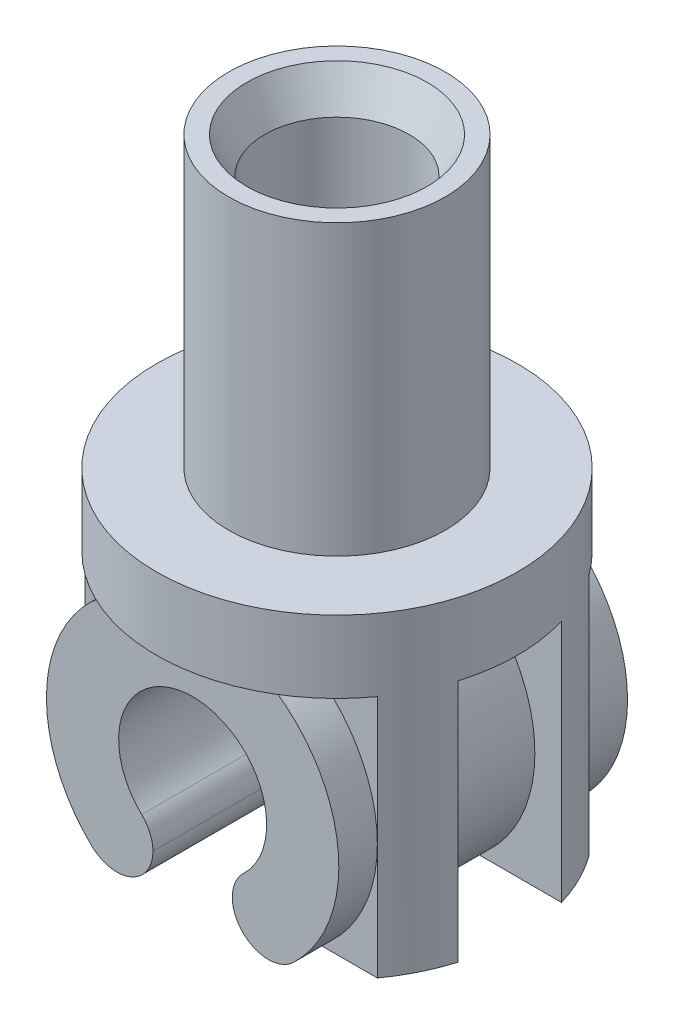
from build123d import *
from build123d.topology import SkipClean

# Parameters (mm, degrees)
BOSS_EXTRUDE9_DEPTH       = 5.6
BOSS_EXTRUDE9_DEPTH_BACK  = 2
SKETCH16_W                = 8
SKETCH16_H                = 3.5
BOSS_EXTRUDE11_DEPTH      = 8
CHAMFER2_SIZE             = 1.5
SKETCH17_W                = 3.94
SKETCH17_H                = 8
BOSS_EXTRUDE12_DEPTH      = 6.3
CUT_EXTRUDE2_START        = -5.6
CUT_EXTRUDE2_DEPTH        = 3.6
SKETCH21_R                = 1.5
BOSS_EXTRUDE14_DEPTH      = 3.6
CHAMFER4_SIZE             = 1
CUT_EXTRUDE3_DEPTH        = 3.6
SPLIT1_START              = -2
SPLIT1_DEPTH              = 7.6
SKETCH22_R                = 5
BOSS_EXTRUDE15_DEPTH      = 2
SKETCH23_R                = 3
BOSS_EXTRUDE16_DEPTH      = 8
CUT_EXTRUDE4_DEPTH        = 32.952026383
CUT_EXTRUDE4_DEPTH_BACK   = 8
SKETCH24_R                = 2
CHAMFER5_SIZE             = 0.5
CHAMFER5_SIZE2            = 1
BOSS_EXTRUDE17_DEPTH      = 8
CUT_EXTRUDE6_DEPTH        = 15.719504629
CUT_EXTRUDE6_DEPTH_BACK   = 15.719504629
FILLET2_R                 = 1
BOSS_EXTRUDE18_REACH      = 31.245
BOSS_EXTRUDE18_END_RADIUS = 4.05
SKETCH27_W                = 2.08
SKETCH27_H                = 1.5
BOSS_EXTRUDE19_START      = 3.538587
SKETCH27_3_W              = 2.08
SKETCH27_3_H              = 1.5
BOSS_EXTRUDE19_DEPTH      = 2.937113
CUT_EXTRUDE7_DEPTH        = 15.289597343
CUT_EXTRUDE7_DEPTH_BACK   = 15.289597343
SKETCH29_W                = 1.95
SKETCH29_H                = 0.274787005
BOSS_EXTRUDE20_DEPTH      = 1.5
BOSS_EXTRUDE21_START      = -4.364299
SKETCH29_3_W              = 1.95
SKETCH29_3_H              = 0.274787005
BOSS_EXTRUDE21_DEPTH      = 1.5
BOSS_EXTRUDE22_DEPTH      = 6.750486925


# Read off the part's stored shape, not the designer's step: Split1
# Some blends are built 0.0001 mm under size
with BuildPart() as part:
    # Sketch14 → Boss-Extrude9 (new, two sides: drawn at the far end of the back side and taken through both)
    with BuildSketch(Plane(origin=(0, 0, 0), x_dir=(1, 0, 0), z_dir=(0, 1, 0)).offset(-BOSS_EXTRUDE9_DEPTH_BACK)):
        with BuildLine():
            Line((-4.172171186, -20.619968889), (-4.172171186, -25.619968889))
            Line((-4.172171186, -25.619968889), (7.827828814, -25.619968889))
            Line((7.827828814, -25.619968889), (7.827828814, -20.619968889))
            ThreePointArc((7.827828814, -20.619968889), (1.827828814, -14.619968889), (-4.172171186, -20.619968889))
        make_face()
    extrude(amount=BOSS_EXTRUDE9_DEPTH + BOSS_EXTRUDE9_DEPTH_BACK)

    # Sketch16 → Boss-Extrude11 (add)
    with BuildSketch(Plane.XY.offset(25.619968889)):
        with Locations((1.827828814, 1.75)):
            Rectangle(SKETCH16_W, SKETCH16_H)
    extrude(amount=BOSS_EXTRUDE11_DEPTH)

    # Chamfer2
    chamfer2_edges = [part.edges().sort_by_distance(p)[0] for p in [
        (1.827828814, -2, 14.619968889),
        (7.827828814, 5.6, 23.119968889),
        (1.827828814, 5.6, 14.619968889),
        (-4.172171186, -2, 23.119968889),
        (-4.172171186, 5.6, 23.119968889),
        (7.827828814, -2, 23.119968889),
    ]]
    chamfer(chamfer2_edges, length=CHAMFER2_SIZE)

    # Sketch17 → Boss-Extrude12 (add)
    with BuildSketch(Plane.XZ.offset(2)):
        with Locations((1.827828814, 21.619968889)):
            Rectangle(SKETCH17_W, SKETCH17_H)
    extrude(amount=BOSS_EXTRUDE12_DEPTH)

    # Sketch20 → Cut-Extrude2 (cut)
    with BuildSketch(Plane(origin=(0, 5.6, 0), x_dir=(1, 0, 0), z_dir=(0, 1, 0)).offset(CUT_EXTRUDE2_START)):
        with BuildLine():
            Line((7.827828814, -20.619968889), (-4.172171186, -20.619968889))
            ThreePointArc((-4.172171186, -20.619968889), (1.827828814, -14.619968889), (7.827828814, -20.619968889))
        make_face()
    extrude(amount=CUT_EXTRUDE2_DEPTH, mode=Mode.SUBTRACT)

    # Sketch21 → Boss-Extrude14 (add)
    with BuildSketch(Plane(origin=(0, 0, 0), x_dir=(1, 0, 0), z_dir=(0, 1, 0))):
        with BuildLine():
            ThreePointArc((7.827828814, -20.619968889), (7.63955943, -19.128732072), (7.086566399, -17.731080001))
            ThreePointArc((7.086566399, -17.731080001), (6.279209969, -19.350325806), (4.990106474, -20.619968889))
            Line((4.990106474, -20.619968889), (7.827828814, -20.619968889))
        make_face()
        with BuildLine():
            ThreePointArc((-1.334448847, -20.619968889), (-2.623552342, -19.350325806), (-3.430908771, -17.731080001))
            ThreePointArc((-3.430908771, -17.731080001), (-3.983901803, -19.128732072), (-4.172171186, -20.619968889))
            Line((-4.172171186, -20.619968889), (-1.334448847, -20.619968889))
        make_face()
        with Locations(Location((1.827828814, -16.119968889, 0), (0, 0, 90.000763944))):
            Circle(SKETCH21_R)
    extrude(amount=BOSS_EXTRUDE14_DEPTH)

    # Chamfer4
    # the kernel refuses this chamfer: 1 mm, written as the material it adds along each edge
    with BuildSketch(Plane(origin=(1.827828814, 3.6, 16.119968889), x_dir=(-1.3333338100422289e-05, 0, -0.999999999911111), z_dir=(0.999999999911111, 0, -1.3333338100422289e-05))) as chamfer4_piece_1_section:
        Polygon((1.5, -CHAMFER4_SIZE), (1.5 + CHAMFER4_SIZE, 0), (1.5, 0), align=None)
    chamfer4_piece_1 = revolve(axis=Axis((1.827828814, 3.6, 16.119968889), (0, 1, 0)), mode=Mode.PRIVATE)
    chamfer4_piece_1 = chamfer4_piece_1 & Plane(origin=(1.827828814, 3.111670507, 20.619968889), x_dir=(1, 0, 0), z_dir=(0, -1, 0)) * Cylinder(6, 10, mode=Mode.PRIVATE)
    add(chamfer4_piece_1)
    with BuildSketch(Plane(origin=(1.827828814, 0, 16.119968889), x_dir=(-1.3333338100422289e-05, 0, -0.999999999911111), z_dir=(0.999999999911111, 0, -1.3333338100422289e-05))) as chamfer4_piece_2_section:
        Polygon((1.5 + CHAMFER4_SIZE, 0), (1.5, CHAMFER4_SIZE), (1.5, 0), align=None)
    chamfer4_piece_2 = revolve(axis=Axis((1.827828814, 0, 16.119968889), (0, 1, 0)), mode=Mode.PRIVATE)
    chamfer4_piece_2 = chamfer4_piece_2 & Plane(origin=(1.827828814, 0.488329493, 20.619968889), x_dir=(1, 0, 0), z_dir=(0, -1, 0)) * Cylinder(6, 10, mode=Mode.PRIVATE)
    add(chamfer4_piece_2)

    # Sketch21<3> → Cut-Extrude3 (cut)
    with BuildSketch(Plane(origin=(0, 0, 0), x_dir=(1, 0, 0), z_dir=(0, 1, 0))):
        with BuildLine():
            Line((4.990106474, -20.619968889), (-1.334448847, -20.619968889))
            ThreePointArc((-1.334448847, -20.619968889), (1.827828814, -21.619968889), (4.990106474, -20.619968889))
        make_face()
    extrude(amount=CUT_EXTRUDE3_DEPTH, mode=Mode.SUBTRACT)

    # Split1 outline → Split1 (cut)
    with BuildSketch(Plane(origin=(0, 0, 0), x_dir=(1, 0, 0), z_dir=(0, 1, 0)).offset(SPLIT1_START)):
        with BuildLine():
            Line((7.827828814, -25.619968889), (7.827828814, -20.619968889))
            ThreePointArc((7.827828814, -20.619968889), (1.827828814, -14.619968889), (-4.172171186, -20.619968889))
            Line((-4.172171186, -20.619968889), (-4.172171186, -25.619968889))
            Line((-4.172171186, -25.619968889), (-2.172171186, -25.619968889))
            Line((-2.172171186, -25.619968889), (-2.172171186, -33.619968889))
            Line((-2.172171186, -33.619968889), (5.827828814, -33.619968889))
            Line((5.827828814, -33.619968889), (5.827828814, -25.619968889))
            Line((5.827828814, -25.619968889), (7.827828814, -25.619968889))
        make_face()
    extrude(amount=SPLIT1_DEPTH, mode=Mode.SUBTRACT)

    # Sketch22 → Boss-Extrude15 (add)
    with BuildSketch(Plane(origin=(0, -2, 0), x_dir=(1, 0, 0), z_dir=(0, 1, 0))):
        with Locations(Location((1.827828814, -21.619968889, 0), (0, 0, 270))):
            Circle(SKETCH22_R)
    extrude(amount=BOSS_EXTRUDE15_DEPTH)

    # Sketch23 → Boss-Extrude16 (add)
    with BuildSketch(Plane(origin=(0, 0, 0), x_dir=(1, 0, 0), z_dir=(0, 1, 0))):
        with Locations(Location((1.827828814, -21.619968889, 0), (0, 0, 270))):
            Circle(SKETCH23_R)
    extrude(amount=BOSS_EXTRUDE16_DEPTH)

    # Sketch24 → Cut-Extrude4 (cut, two sides: drawn at the far end of the back side and taken through both)
    with BuildSketch(Plane(origin=(0, 8, 0), x_dir=(1, 0, 0), z_dir=(0, 1, 0)).offset(-CUT_EXTRUDE4_DEPTH_BACK)):
        with Locations(Location((1.827828814, -21.619968889, 0), (0, 0, 270))):
            Circle(SKETCH24_R)
    extrude(amount=CUT_EXTRUDE4_DEPTH + CUT_EXTRUDE4_DEPTH_BACK, mode=Mode.SUBTRACT)

    # Chamfer5
    chamfer5_edges = [part.edges().sort_by_distance(p)[0] for p in [
        (1.827828814, 8, 19.619968889),
    ]]
    chamfer5_side = [part.faces().sort_by_distance(p)[0] for p in [
        (1.827828814, 8, 18.704821703),
    ]]
    chamfer(chamfer5_edges, length=CHAMFER5_SIZE, length2=CHAMFER5_SIZE2, reference=chamfer5_side[0])

    # Sketch25 → Boss-Extrude17 (add)
    with BuildSketch(Plane.XY.offset(25.619968889)):
        with BuildLine():
            Line((3.797828814, -8.3), (2.927828814, -8.3))
            Line((2.927828814, -8.3), (2.927828814, -9.436343053))
            ThreePointArc((2.927828814, -9.436343053), (5.057186335, -7.982712899), (5.877828814, -5.538587289))
            ThreePointArc((5.877828814, -5.538587289), (5.319318467, -3.486271524), (3.797828814, -2))
            Line((3.797828814, -2), (3.797828814, -4.971489414))
            ThreePointArc((3.797828814, -4.971489414), (3.857730289, -5.252230867), (3.877828814, -5.538587289))
            ThreePointArc((3.877828814, -5.538587289), (3.857730289, -5.82494371), (3.797828814, -6.105685164))
            Line((3.797828814, -6.105685164), (3.797828814, -8.3))
        make_face()
        with BuildLine():
            Line((0.727828814, -9.436343053), (0.727828814, -8.3))
            Line((0.727828814, -8.3), (-0.142171186, -8.3))
            Line((-0.142171186, -8.3), (-0.142171186, -6.105685164))
            ThreePointArc((-0.142171186, -6.105685164), (-0.222171186, -5.538587289), (-0.142171186, -4.971489414))
            Line((-0.142171186, -4.971489414), (-0.142171186, -2))
            ThreePointArc((-0.142171186, -2), (-2.194735605, -6.009199123), (0.727828814, -9.436343053))
        make_face()
        with BuildLine():
            Line((-0.142171186, -2), (-0.142171186, -4.971489414))
            ThreePointArc((-0.142171186, -4.971489414), (1.827828814, -3.488587289), (3.797828814, -4.971489414))
            Line((3.797828814, -4.971489414), (3.797828814, -2))
            Line((3.797828814, -2), (-0.142171186, -2))
        make_face()
        with BuildLine():
            ThreePointArc((3.797828814, -6.105685164), (3.469243788, -6.766698391), (2.927828814, -7.268471678))
            Line((2.927828814, -7.268471678), (2.927828814, -8.3))
            Line((2.927828814, -8.3), (3.797828814, -8.3))
            Line((3.797828814, -8.3), (3.797828814, -6.105685164))
        make_face()
        with BuildLine():
            Line((0.727828814, -8.3), (0.727828814, -7.268471678))
            ThreePointArc((0.727828814, -7.268471678), (0.186413839, -6.766698391), (-0.142171186, -6.105685164))
            Line((-0.142171186, -6.105685164), (-0.142171186, -8.3))
            Line((-0.142171186, -8.3), (0.727828814, -8.3))
        make_face()
    extrude(amount=-BOSS_EXTRUDE17_DEPTH)

    # Sketch25<3> → Cut-Extrude6 (cut, two sides: drawn at the far end of the back side and taken through both)
    with BuildSketch(Plane.XY.offset(25.619968889).offset(-CUT_EXTRUDE6_DEPTH_BACK)):
        with BuildLine():
            ThreePointArc((-0.142171186, -6.105685164), (0.186413839, -6.766698391), (0.727828814, -7.268471678))
            Line((0.727828814, -7.268471678), (0.727828814, -8.3))
            Line((0.727828814, -8.3), (2.927828814, -8.3))
            Line((2.927828814, -8.3), (2.927828814, -7.268471678))
            ThreePointArc((2.927828814, -7.268471678), (3.469243788, -6.766698391), (3.797828814, -6.105685164))
            Line((3.797828814, -6.105685164), (3.797828814, -4.971489414))
            ThreePointArc((3.797828814, -4.971489414), (1.827828814, -3.488587289), (-0.142171186, -4.971489414))
            Line((-0.142171186, -4.971489414), (-0.142171186, -6.105685164))
        make_face()
    extrude(amount=CUT_EXTRUDE6_DEPTH + CUT_EXTRUDE6_DEPTH_BACK, mode=Mode.SUBTRACT)

    # Fillet2
    fillet2_edges = [part.edges().sort_by_distance(p)[0] for p in [
        (0.727828814, -7.268471678, 21.619968889),
        (2.927828814, -7.268471678, 21.619968889),
        (2.927828814, -9.436343053, 21.619968889),
        (0.727828814, -9.436343053, 21.619968889),
    ]]
    fillet(fillet2_edges, radius=FILLET2_R - 0.0001)  # a hair under: the kernel refuses the full size

    # Boss-Extrude18: up to this cylinder (the profile starts outside it)
    boss_extrude18_end = Plane(origin=(1.827828814, -5.538587289, 21.619969), z_dir=(0, 0, 1)) * Cylinder(BOSS_EXTRUDE18_END_RADIUS, 75.954298, mode=Mode.PRIVATE)
    # Sketch27 → Boss-Extrude18 (add, up to the surface)
    with BuildSketch(Plane.XZ.offset(2), mode=Mode.PRIVATE) as boss_extrude18_sk1:
        with Locations((-1.182171186, 23.802118272)):
            Rectangle(SKETCH27_W, SKETCH27_H)
    boss_extrude18_tool1 = extrude(boss_extrude18_sk1.sketch, amount=BOSS_EXTRUDE18_REACH, mode=Mode.PRIVATE) - boss_extrude18_end
    add(boss_extrude18_tool1.solids().sort_by_distance((-1.182171, -2, 23.802118))[0])
    # Sketch27 → Boss-Extrude18 (add, up to the surface)
    with BuildSketch(Plane.XZ.offset(2), mode=Mode.PRIVATE) as boss_extrude18_sk2:
        with Locations((4.837828814, 23.802118272)):
            Rectangle(SKETCH27_W, SKETCH27_H)
    boss_extrude18_tool2 = extrude(boss_extrude18_sk2.sketch, amount=BOSS_EXTRUDE18_REACH, mode=Mode.PRIVATE) - boss_extrude18_end
    add(boss_extrude18_tool2.solids().sort_by_distance((4.837829, -2, 23.802118))[0])
    # Sketch27 → Boss-Extrude18 (add, up to the surface)
    with BuildSketch(Plane.XZ.offset(2), mode=Mode.PRIVATE) as boss_extrude18_sk3:
        with Locations((4.837828814, 19.437819507)):
            Rectangle(SKETCH27_W, SKETCH27_H)
    boss_extrude18_tool3 = extrude(boss_extrude18_sk3.sketch, amount=BOSS_EXTRUDE18_REACH, mode=Mode.PRIVATE) - boss_extrude18_end
    add(boss_extrude18_tool3.solids().sort_by_distance((4.837829, -2, 19.43782))[0])
    # Sketch27 → Boss-Extrude18 (add, up to the surface)
    with BuildSketch(Plane.XZ.offset(2), mode=Mode.PRIVATE) as boss_extrude18_sk4:
        with Locations((-1.182171186, 19.437819507)):
            Rectangle(SKETCH27_W, SKETCH27_H)
    boss_extrude18_tool4 = extrude(boss_extrude18_sk4.sketch, amount=BOSS_EXTRUDE18_REACH, mode=Mode.PRIVATE) - boss_extrude18_end
    add(boss_extrude18_tool4.solids().sort_by_distance((-1.182171, -2, 19.43782))[0])

    # Sketch27<3> → Boss-Extrude19 (add)
    with BuildSketch(Plane.XZ.offset(2).offset(BOSS_EXTRUDE19_START)):
        with Locations((-1.182171186, 19.437819507)):
            Rectangle(SKETCH27_3_W, SKETCH27_3_H)
        with Locations((4.837828814, 19.437819507)):
            Rectangle(SKETCH27_3_W, SKETCH27_3_H)
        with Locations((4.837828814, 23.802118272)):
            Rectangle(SKETCH27_3_W, SKETCH27_3_H)
        with Locations((-1.182171186, 23.802118272)):
            Rectangle(SKETCH27_3_W, SKETCH27_3_H)
    extrude(amount=BOSS_EXTRUDE19_DEPTH)

    # Sketch25<5> → Cut-Extrude7 (cut, two sides: drawn at the far end of the back side and taken through both)
    with SkipClean():  # the faces are left unmerged after this step: merging them gives an invalid solid
        with BuildSketch(Plane.XY.offset(25.619968889).offset(-CUT_EXTRUDE7_DEPTH_BACK)):
            with BuildLine():
                ThreePointArc((-0.142171186, -6.105685164), (0.186413839, -6.766698391), (0.727828814, -7.268471678))
                Line((0.727828814, -7.268471678), (2.927828814, -7.268471678))
                ThreePointArc((2.927828814, -7.268471678), (3.469243788, -6.766698391), (3.797828814, -6.105685164))
                Line((3.797828814, -6.105685164), (3.797828814, -4.971489414))
                ThreePointArc((3.797828814, -4.971489414), (1.827828814, -3.488587289), (-0.142171186, -4.971489414))
                Line((-0.142171186, -4.971489414), (-0.142171186, -6.105685164))
            make_face()
            with BuildLine():
                Line((3.797828814, -4.971489414), (3.797828814, -6.105685164))
                ThreePointArc((3.797828814, -6.105685164), (3.857730289, -5.82494371), (3.877828814, -5.538587289))
                ThreePointArc((3.877828814, -5.538587289), (3.857730289, -5.252230867), (3.797828814, -4.971489414))
            make_face()
            with BuildLine():
                ThreePointArc((-0.142171186, -4.971489414), (-0.222171186, -5.538587289), (-0.142171186, -6.105685164))
                Line((-0.142171186, -6.105685164), (-0.142171186, -4.971489414))
            make_face()
        extrude(amount=CUT_EXTRUDE7_DEPTH + CUT_EXTRUDE7_DEPTH_BACK, mode=Mode.SUBTRACT)

    # Sketch29 → Boss-Extrude20 (add)
    with SkipClean():  # the faces are left unmerged after this step: merging them gives an invalid solid
        with BuildSketch(Plane.XY.offset(24.552118272)):
            with Locations((-1.247171186, -8.613093423)):
                Rectangle(SKETCH29_W, SKETCH29_H)
            with Locations((4.902828814, -8.613093423)):
                Rectangle(SKETCH29_W, SKETCH29_H)
        extrude(amount=-BOSS_EXTRUDE20_DEPTH)

    # Sketch29<3> → Boss-Extrude21 (add)
    with SkipClean():  # the faces are left unmerged after this step: merging them gives an invalid solid
        with BuildSketch(Plane.XY.offset(24.552118272).offset(BOSS_EXTRUDE21_START)):
            with Locations((-1.247171186, -8.613093423)):
                Rectangle(SKETCH29_3_W, SKETCH29_3_H)
            with Locations((4.902828814, -8.613093423)):
                Rectangle(SKETCH29_3_W, SKETCH29_3_H)
        extrude(amount=-BOSS_EXTRUDE21_DEPTH)

    # Sketch30 → Boss-Extrude22 (add)
    with SkipClean():  # the faces are left unmerged after this step: merging them gives an invalid solid
        with BuildSketch(Plane.XZ.offset(8.750486925)):
            with BuildLine():
                Line((5.877828814, 23.052118272), (6.618334857, 23.052118272))
                ThreePointArc((6.618334857, 23.052118272), (6.311257945, 23.833306466), (5.877828814, 24.552118272))
                Line((5.877828814, 24.552118272), (5.877828814, 23.052118272))
            make_face()
            with BuildLine():
                Line((5.877828814, 20.187819507), (6.618334857, 20.187819507))
                ThreePointArc((6.618334857, 20.187819507), (6.311257945, 19.406631313), (5.877828814, 18.687819507))
                Line((5.877828814, 18.687819507), (5.877828814, 20.187819507))
            make_face()
            with BuildLine():
                Line((-2.222171186, 20.187819507), (-2.962677229, 20.187819507))
                ThreePointArc((-2.962677229, 20.187819507), (-2.655600317, 19.406631313), (-2.222171186, 18.687819507))
                Line((-2.222171186, 18.687819507), (-2.222171186, 20.187819507))
            make_face()
            with BuildLine():
                Line((-2.222171186, 23.052118272), (-2.962677229, 23.052118272))
                ThreePointArc((-2.962677229, 23.052118272), (-2.655600317, 23.833306466), (-2.222171186, 24.552118272))
                Line((-2.222171186, 24.552118272), (-2.222171186, 23.052118272))
            make_face()
        extrude(amount=-BOSS_EXTRUDE22_DEPTH)


solid = part.part
